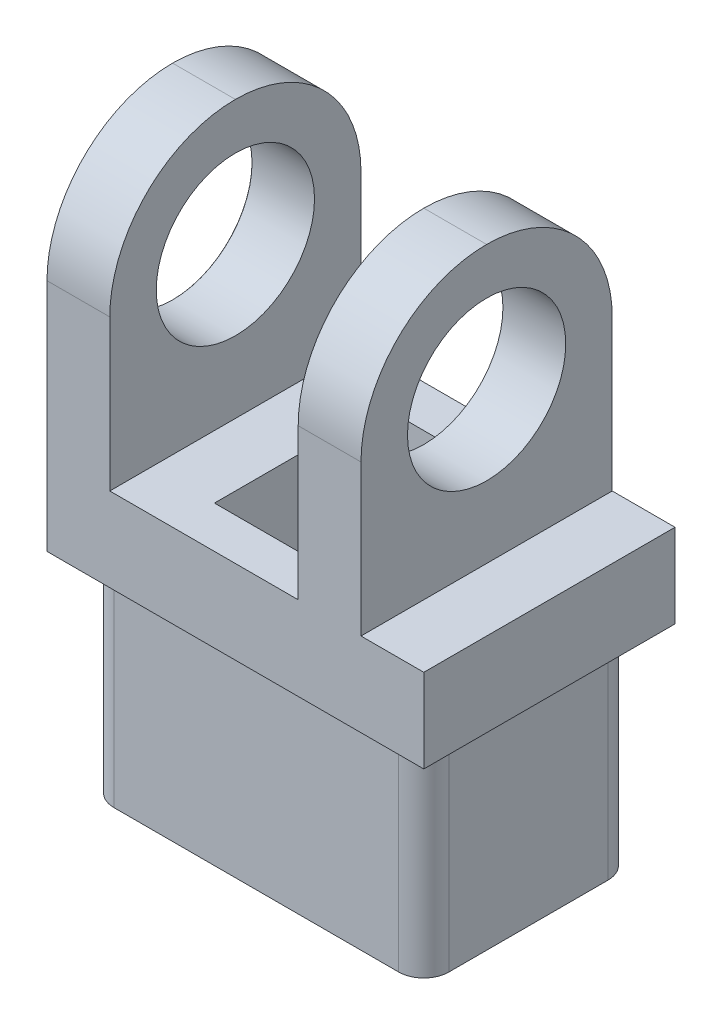
from build123d import *

# Parameters (mm, degrees)
SKETCH2_W                        = 4.7625
SKETCH2_H                        = 19.05
BOSS_EXTRUDE1_DEPTH              = 20.955
BOSS_EXTRUDE1_2_DEPTH            = 20.955
SKETCH3_W                        = 25.4
SKETCH3_H                        = 15.875
BOSS_EXTRUDE2_DEPTH              = 22.225
SKETCH2_3_W                      = 14.2875
SKETCH2_3_H                      = 19.05
SKETCH2_3_W_2                    = 4.7625
BOSS_EXTRUDE3_DEPTH              = 6.35
FILLET1_R                        = 9.525
F_12_0MM_DOWEL_HOLE1_D           = 12
F_12_0MM_DOWEL_HOLE1_CSINK_D     = 12.05
F_12_0MM_DOWEL_HOLE1_CSINK_ANGLE = 90
FILLET2_R                        = 1.905
SKETCH5_W                        = 9.525
SKETCH5_H                        = 12.7
CUT_EXTRUDE1_DEPTH               = 41.907013457


with BuildPart() as part:
    # Sketch2 → Boss-Extrude1 (new body)
    with BuildSketch(Plane(origin=(0, 0, 0), x_dir=(1, 0, 0), z_dir=(0, 1, 0))):
        with Locations((2.38125, 9.525)):
            Rectangle(SKETCH2_W, SKETCH2_H)
    extrude(amount=BOSS_EXTRUDE1_DEPTH)



with BuildPart() as body_2:
    # Sketch2 → Boss-Extrude1 2 (new body)
    with BuildSketch(Plane(origin=(0, 0, 0), x_dir=(1, 0, 0), z_dir=(0, 1, 0))):
        with Locations((21.43125, 9.525)):
            Rectangle(SKETCH2_W, SKETCH2_H)
    extrude(amount=BOSS_EXTRUDE1_2_DEPTH)


with BuildPart() as part_1:
    add(part.part)

    add(body_2.part)  # Boss-Extrude2 merges body 2
    # Sketch3 → Boss-Extrude2 (add)
    with BuildSketch(Plane(origin=(0, 0, 0), x_dir=(1, 0, 0), z_dir=(0, 1, 0))):
        with Locations((14.2875, 9.525)):
            Rectangle(SKETCH3_W, SKETCH3_H)
    extrude(amount=-BOSS_EXTRUDE2_DEPTH)

    # Sketch2<3> → Boss-Extrude3 (add)
    with BuildSketch(Plane(origin=(0, 0, 0), x_dir=(1, 0, 0), z_dir=(0, 1, 0))):
        with Locations((11.90625, 9.525)):
            Rectangle(SKETCH2_3_W, SKETCH2_3_H)
        with Locations((26.19375, 9.525)):
            Rectangle(SKETCH2_3_W_2, SKETCH2_3_H)
        with Locations((2.38125, 9.525)):
            Rectangle(SKETCH2_3_W_2, SKETCH2_3_H)
        with Locations((21.43125, 9.525)):
            Rectangle(SKETCH2_3_W_2, SKETCH2_3_H)
    extrude(amount=-BOSS_EXTRUDE3_DEPTH)

    # Fillet1
    fillet1_edges = [part_1.edges().sort_by_distance(p)[0] for p in [
        (2.38125, 20.955, -19.05),
        (2.38125, 20.955, 0),
        (21.43125, 20.955, 0),
        (21.43125, 20.955, -19.05),
    ]]
    fillet(fillet1_edges, radius=FILLET1_R - 0.0001)  # a hair under: the kernel refuses the full size

    # Ø12.0mm Dowel Hole1 (through all)
    with Locations(Plane(origin=(0, 11.43, -9.525), x_dir=(0, 0, -1), z_dir=(-1, 0, 0))):
        with Locations((0, 0)):
            CounterSinkHole(F_12_0MM_DOWEL_HOLE1_D / 2, F_12_0MM_DOWEL_HOLE1_CSINK_D / 2, counter_sink_angle=F_12_0MM_DOWEL_HOLE1_CSINK_ANGLE)

    # Fillet2
    fillet2_edges = [part_1.edges().sort_by_distance(p)[0] for p in [
        (1.5875, -14.2875, -1.5875),
        (1.5875, -14.2875, -17.4625),
        (26.9875, -14.2875, -17.4625),
        (26.9875, -14.2875, -1.5875),
    ]]
    fillet(fillet2_edges, radius=FILLET2_R)

    # Sketch5 → Cut-Extrude1 (cut, through all)
    with BuildSketch(Plane(origin=(0, 0, 0), x_dir=(1, 0, 0), z_dir=(0, 1, 0))):
        with Locations((14.2875, 9.525)):
            Rectangle(SKETCH5_W, SKETCH5_H)
    extrude(amount=-CUT_EXTRUDE1_DEPTH, mode=Mode.SUBTRACT)


solid = part_1.part
